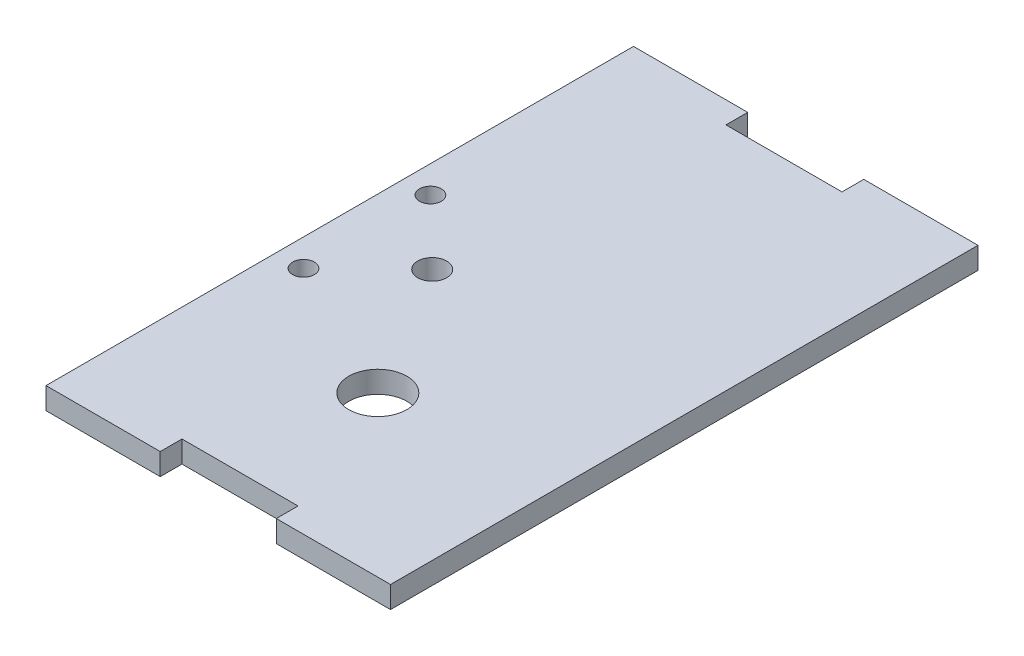
from build123d import *

# Parameters (mm, degrees)
CROQUIS1_R              = 1.5
CROQUIS1_R_2            = 2
CROQUIS1_R_3            = 4
SALIENTE_EXTRUIR1_DEPTH = 3


with BuildPart() as part:
    # Croquis1 → Saliente-Extruir1 (new body)
    with BuildSketch(Plane(origin=(0, 0, 0), x_dir=(1, 0, 0), z_dir=(0, 1, 0))):
        Polygon((0, 0), (15.75, 0), (15.75, 3), (23.75, 3), (31.75, 3), (31.75, 0), (47.5, 0), (47.5, 81), (31.75, 81), (31.75, 78), (23.75, 78), (15.75, 78), (15.75, 81), (0, 81), align=None)
        with Locations((3.75, 49.25)):
            Circle(CROQUIS1_R, mode=Mode.SUBTRACT)
        with Locations((3.75, 31.75)):
            Circle(CROQUIS1_R, mode=Mode.SUBTRACT)
        with Locations((12.75, 40.5)):
            Circle(CROQUIS1_R_2, mode=Mode.SUBTRACT)
        with Locations((23.75, 22)):
            Circle(CROQUIS1_R_3, mode=Mode.SUBTRACT)
    extrude(amount=SALIENTE_EXTRUIR1_DEPTH)


solid = part.part
